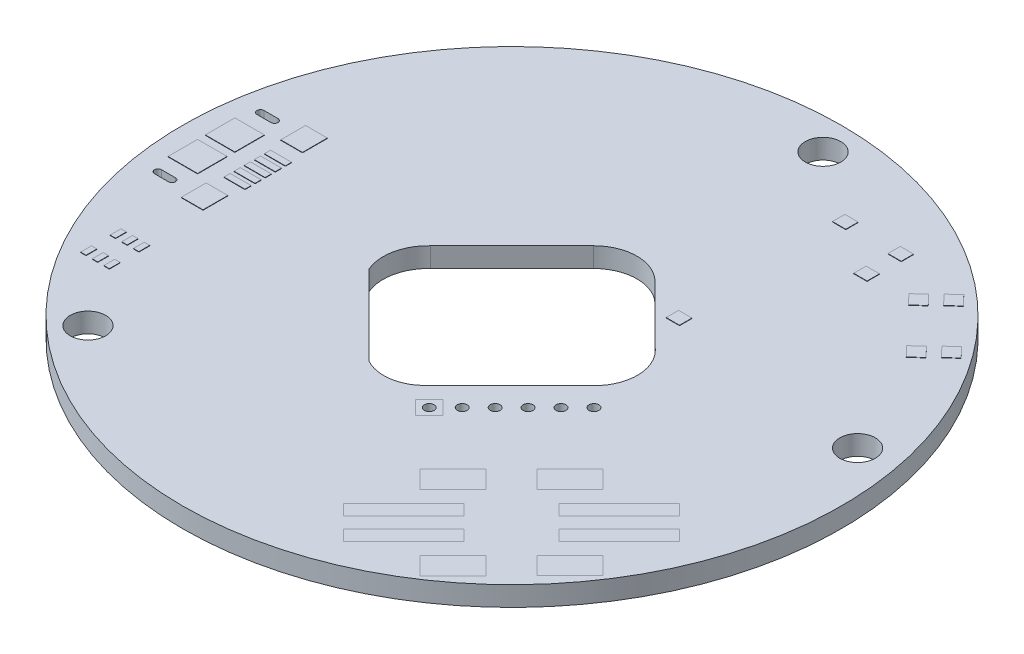
from build123d import *

# Parameters (mm, degrees)
SKETCH3_R                   = 21.209
SKETCH3_R_2                 = 1.143
SKETCH3_R_3                 = 0.3175
BOSS_EXTRUDE1_DEPTH         = 1.27
BOSS_EXTRUDE3_DEPTH         = 1.27
BOSS_EXTRUDE3_2_DEPTH       = 1.27
BOSS_EXTRUDE3_3_DEPTH       = 1.27
BOSS_EXTRUDE3_4_DEPTH       = 1.27
BOSS_EXTRUDE3_5_DEPTH       = 1.27
BOSS_EXTRUDE3_6_DEPTH       = 1.27
BOSS_EXTRUDE3_7_DEPTH       = 1.27
BOSS_EXTRUDE3_8_DEPTH       = 1.27
BOSS_EXTRUDE3_9_DEPTH       = 1.27
SKETCH5_R                   = 0.3175
CUT_EXTRUDE1_DEPTH          = 1.27
BOSS_EXTRUDE5_DEPTH         = 0.0254
BOSS_EXTRUDE5_DEPTH_BACK    = 1.27
SKETCH6_W                   = 0.350012
SKETCH6_H                   = 0.6999986
BOSS_EXTRUDE5_2_DEPTH       = 0.0254
BOSS_EXTRUDE5_2_DEPTH_BACK  = 1.27
BOSS_EXTRUDE5_3_DEPTH       = 0.0254
BOSS_EXTRUDE5_3_DEPTH_BACK  = 1.27
BOSS_EXTRUDE5_4_DEPTH       = 0.0254
BOSS_EXTRUDE5_4_DEPTH_BACK  = 1.27
BOSS_EXTRUDE5_5_DEPTH       = 0.0254
BOSS_EXTRUDE5_5_DEPTH_BACK  = 1.27
BOSS_EXTRUDE5_6_DEPTH       = 0.0254
BOSS_EXTRUDE5_6_DEPTH_BACK  = 1.27
BOSS_EXTRUDE5_7_DEPTH       = 0.0254
BOSS_EXTRUDE5_7_DEPTH_BACK  = 1.27
SKETCH6_W_2                 = 1.3999972
SKETCH6_H_2                 = 1.5999968
BOSS_EXTRUDE5_8_DEPTH       = 0.0254
BOSS_EXTRUDE5_8_DEPTH_BACK  = 1.27
SKETCH6_W_3                 = 1.8999962
SKETCH6_H_3                 = 1.8999962
BOSS_EXTRUDE5_9_DEPTH       = 0.0254
BOSS_EXTRUDE5_9_DEPTH_BACK  = 1.27
BOSS_EXTRUDE5_10_DEPTH      = 0.0254
BOSS_EXTRUDE5_10_DEPTH_BACK = 1.27
BOSS_EXTRUDE5_11_DEPTH      = 0.0254
BOSS_EXTRUDE5_11_DEPTH_BACK = 1.27
SKETCH6_W_4                 = 1.35001
SKETCH6_H_4                 = 0.3999992
BOSS_EXTRUDE5_12_DEPTH      = 0.0254
BOSS_EXTRUDE5_12_DEPTH_BACK = 1.27
BOSS_EXTRUDE5_13_DEPTH      = 0.0254
BOSS_EXTRUDE5_13_DEPTH_BACK = 1.27
BOSS_EXTRUDE5_14_DEPTH      = 0.0254
BOSS_EXTRUDE5_14_DEPTH_BACK = 1.27
BOSS_EXTRUDE5_15_DEPTH      = 0.0254
BOSS_EXTRUDE5_15_DEPTH_BACK = 1.27
CUT_EXTRUDE2_DEPTH          = 1.27
BOSS_EXTRUDE6_DEPTH         = 0.0254
BOSS_EXTRUDE6_DEPTH_BACK    = 1.27
BOSS_EXTRUDE6_2_DEPTH       = 0.0254
BOSS_EXTRUDE6_2_DEPTH_BACK  = 1.27
BOSS_EXTRUDE6_3_DEPTH       = 0.0254
BOSS_EXTRUDE6_3_DEPTH_BACK  = 1.27
BOSS_EXTRUDE6_4_DEPTH       = 0.0254
BOSS_EXTRUDE6_4_DEPTH_BACK  = 1.27
BOSS_EXTRUDE6_5_DEPTH       = 0.0254
BOSS_EXTRUDE6_5_DEPTH_BACK  = 1.27
BOSS_EXTRUDE6_6_DEPTH       = 0.0254
BOSS_EXTRUDE6_6_DEPTH_BACK  = 1.27
BOSS_EXTRUDE6_7_DEPTH       = 0.0254
BOSS_EXTRUDE6_7_DEPTH_BACK  = 1.27
BOSS_EXTRUDE6_8_DEPTH       = 0.0254
BOSS_EXTRUDE6_8_DEPTH_BACK  = 1.27
BOSS_EXTRUDE8_DEPTH         = 1.778
BOSS_EXTRUDE9_START         = -0.00254
BOSS_EXTRUDE9_OUTLINE_W     = 0.8599932
BOSS_EXTRUDE9_OUTLINE_H     = 0.7999984
BOSS_EXTRUDE9_DEPTH         = 0.02794
BOSS_EXTRUDE9_2_OUTLINE_W   = 0.8599932
BOSS_EXTRUDE9_2_OUTLINE_H   = 0.7999984
BOSS_EXTRUDE9_2_DEPTH       = 0.02794
BOSS_EXTRUDE9_3_DEPTH       = 0.02794
BOSS_EXTRUDE9_4_DEPTH       = 0.02794
BOSS_EXTRUDE9_5_DEPTH       = 0.02794
BOSS_EXTRUDE9_6_DEPTH       = 0.02794
BOSS_EXTRUDE9_7_OUTLINE_W   = 0.8599932
BOSS_EXTRUDE9_7_OUTLINE_H   = 0.7999984
BOSS_EXTRUDE9_7_DEPTH       = 0.02794
BOSS_EXTRUDE9_8_OUTLINE_W   = 0.8599932
BOSS_EXTRUDE9_8_OUTLINE_H   = 0.7999984
BOSS_EXTRUDE9_8_DEPTH       = 0.02794


# Read off the part's stored shape, not the designer's step: Boss-Extrude8, Boss-Extrude9
with BuildPart() as part:
    # Sketch3 → Boss-Extrude1 (new body)
    with BuildSketch(Plane(origin=(0, 0, 0), x_dir=(1, 0, 0), z_dir=(0, 1, 0))):
        with Locations(Location((0, 0, 0), (0, 0, 270))):
            Circle(SKETCH3_R)
        with Locations(Location((-13.090326502, -14.20017464, 0), (0, 0, 270))):
            Circle(SKETCH3_R_2, mode=Mode.SUBTRACT)
        with BuildLine():
            ThreePointArc((-1.2703302, 6.519164), (0.698070661, 7.338252187), (2.6717498, 6.5319656))
            Line((2.6717498, 6.5319656), (6.578981, 2.6405078))
            ThreePointArc((6.578981, 2.6405078), (7.363740488, 0.814468366), (6.7227958, -1.0668762))
            ThreePointArc((6.7227958, -1.0668762), (3.871033901, -3.904885416), (1.0291826, -6.7528186))
            ThreePointArc((1.0291826, -6.7528186), (-0.462677673, -7.449933453), (-2.0779994, -7.1300086))
            Line((-2.0779994, -7.1300086), (-7.1967344, -2.0112482))
            ThreePointArc((-7.1967344, -2.0112482), (-7.376547613, -0.261337244), (-6.5163446, 1.2731242))
            Line((-6.5163446, 1.2731242), (-1.2703302, 6.519164))
        make_face(mode=Mode.SUBTRACT)
        Polygon((10.345452676, -13.426869757), (11.052558043, -14.133975124), (7.163478524, -18.023054643), (6.456373157, -17.315949276), align=None, mode=Mode.SUBTRACT)
        Polygon((8.931231476, -12.012648557), (9.638336843, -12.719753924), (5.749257324, -16.608833443), (5.042151957, -15.901728076), align=None, mode=Mode.SUBTRACT)
        Polygon((7.729147757, -9.396368656), (8.860516344, -10.527737243), (6.739200243, -12.649053344), (5.607831656, -11.517684757), align=None, mode=Mode.SUBTRACT)
        Polygon((12.537494757, -14.204690256), (13.668863344, -15.336058843), (11.547547243, -17.457374944), (10.416178656, -16.326006357), align=None, mode=Mode.SUBTRACT)
        Polygon((15.297450843, -13.694237944), (14.166082256, -12.562869357), (16.287398357, -10.441553256), (17.418766944, -11.572921843), align=None, mode=Mode.SUBTRACT)
        Polygon((14.095367124, -11.077958043), (13.388261757, -10.370852676), (17.277341276, -6.481773157), (17.984446643, -7.188878524), align=None, mode=Mode.SUBTRACT)
        Polygon((3.361901812, -7.7877162), (2.4638762, -8.685741812), (1.565850588, -7.7877162), (2.4638762, -6.889690588), align=None, mode=Mode.SUBTRACT)
        with Locations(Location((3.5235388, -6.7280536, 0), (0, 0, 270))):
            Circle(SKETCH3_R_3, mode=Mode.SUBTRACT)
        with Locations(Location((4.5832014, -5.668391, 0), (0, 0, 270))):
            Circle(SKETCH3_R_3, mode=Mode.SUBTRACT)
        with Locations(Location((5.6428894, -4.608703, 0), (0, 0, 270))):
            Circle(SKETCH3_R_3, mode=Mode.SUBTRACT)
        with Locations(Location((6.702552, -3.5490404, 0), (0, 0, 270))):
            Circle(SKETCH3_R_3, mode=Mode.SUBTRACT)
        with Locations(Location((7.7622146, -2.4893778, 0), (0, 0, 270))):
            Circle(SKETCH3_R_3, mode=Mode.SUBTRACT)
        Polygon((10.489129243, -8.885916344), (9.357760656, -7.754547757), (11.479076757, -5.633231656), (12.610445344, -6.764600243), align=None, mode=Mode.SUBTRACT)
        Polygon((12.681171324, -9.663736843), (11.974065957, -8.956631476), (15.863145476, -5.067551957), (16.570250843, -5.774657324), align=None, mode=Mode.SUBTRACT)
        with Locations(Location((0.879673498, 19.13732536, 0), (0, 0, 270))):
            Circle(SKETCH3_R_2, mode=Mode.SUBTRACT)
        with Locations(Location((18.500923498, 3.73857536, 0), (0, 0, 270))):
            Circle(SKETCH3_R_2, mode=Mode.SUBTRACT)
    extrude(amount=-BOSS_EXTRUDE1_DEPTH)

    # Sketch6<4> → Cut-Extrude2 (cut)
    with BuildSketch(Plane(origin=(0, 0, 0), x_dir=(1, 0, 0), z_dir=(0, 1, 0))):
        with BuildLine():
            Line((-18.514082797, 3.003570258), (-19.414080997, 3.003570258))
            ThreePointArc((-19.414080997, 3.003570258), (-19.639080547, 3.228569808), (-19.414080997, 3.453569358))
            Line((-19.414080997, 3.453569358), (-18.514082797, 3.453569358))
            ThreePointArc((-18.514082797, 3.453569358), (-18.289083247, 3.228569808), (-18.514082797, 3.003570258))
        make_face()
        with BuildLine():
            Line((-18.514082797, -3.596416542), (-19.414080997, -3.596416542))
            ThreePointArc((-19.414080997, -3.596416542), (-19.639080547, -3.371416992), (-19.414080997, -3.146417442))
            Line((-19.414080997, -3.146417442), (-18.514082797, -3.146417442))
            ThreePointArc((-18.514082797, -3.146417442), (-18.289083247, -3.371416992), (-18.514082797, -3.596416542))
        make_face()
    extrude(amount=-CUT_EXTRUDE2_DEPTH, mode=Mode.SUBTRACT)

    # Boss-Extrude8 outline → Boss-Extrude8 (add)
    with BuildSketch(Plane.XZ.offset(1.27)):
        Polygon((-9.362084568, -9.903882913), (-9.362084568, -13.383772745), (-4.051602282, -13.383772745), (-4.078868321, -9.903882913), align=None)
    extrude(amount=BOSS_EXTRUDE8_DEPTH)


with BuildPart() as body_2:
    # Sketch3<4> → Boss-Extrude3 (new body)
    with BuildSketch(Plane(origin=(0, 0, 0), x_dir=(1, 0, 0), z_dir=(0, 1, 0))):
        Polygon((5.042151957, -15.901728076), (5.749257324, -16.608833443), (9.638336843, -12.719753924), (8.931231476, -12.012648557), align=None)
    extrude(amount=-BOSS_EXTRUDE3_DEPTH)


with BuildPart() as body_3:
    # Sketch3<4> → Boss-Extrude3 2 (new body)
    with BuildSketch(Plane(origin=(0, 0, 0), x_dir=(1, 0, 0), z_dir=(0, 1, 0))):
        Polygon((5.607831656, -11.517684757), (6.739200243, -12.649053344), (8.860516344, -10.527737243), (7.729147757, -9.396368656), align=None)
    extrude(amount=-BOSS_EXTRUDE3_2_DEPTH)


with BuildPart() as body_4:
    # Sketch3<4> → Boss-Extrude3 3 (new body)
    with BuildSketch(Plane(origin=(0, 0, 0), x_dir=(1, 0, 0), z_dir=(0, 1, 0))):
        Polygon((12.610445344, -6.764600243), (11.479076757, -5.633231656), (9.357760656, -7.754547757), (10.489129243, -8.885916344), align=None)
    extrude(amount=-BOSS_EXTRUDE3_3_DEPTH)


with BuildPart() as body_5:
    # Sketch3<4> → Boss-Extrude3 4 (new body)
    with BuildSketch(Plane(origin=(0, 0, 0), x_dir=(1, 0, 0), z_dir=(0, 1, 0))):
        Polygon((16.570250843, -5.774657324), (15.863145476, -5.067551957), (11.974065957, -8.956631476), (12.681171324, -9.663736843), align=None)
    extrude(amount=-BOSS_EXTRUDE3_4_DEPTH)


with BuildPart() as body_6:
    # Sketch3<4> → Boss-Extrude3 5 (new body)
    with BuildSketch(Plane(origin=(0, 0, 0), x_dir=(1, 0, 0), z_dir=(0, 1, 0))):
        Polygon((17.984446643, -7.188878524), (17.277341276, -6.481773157), (13.388261757, -10.370852676), (14.095367124, -11.077958043), align=None)
    extrude(amount=-BOSS_EXTRUDE3_5_DEPTH)


with BuildPart() as body_7:
    # Sketch3<4> → Boss-Extrude3 6 (new body)
    with BuildSketch(Plane(origin=(0, 0, 0), x_dir=(1, 0, 0), z_dir=(0, 1, 0))):
        Polygon((2.4638762, -6.889690588), (1.565850588, -7.7877162), (2.4638762, -8.685741812), (3.361901812, -7.7877162), align=None)
    extrude(amount=-BOSS_EXTRUDE3_6_DEPTH)

    # Sketch5 → Cut-Extrude1 (cut)
    with BuildSketch(Plane(origin=(0, 0, 0), x_dir=(1, 0, 0), z_dir=(0, 1, 0))):
        with Locations(Location((2.4638762, -7.7877162, 0), (0, 0, 270))):
            Circle(SKETCH5_R)
    extrude(amount=-CUT_EXTRUDE1_DEPTH, mode=Mode.SUBTRACT)


with BuildPart() as body_8:
    # Sketch3<4> → Boss-Extrude3 7 (new body)
    with BuildSketch(Plane(origin=(0, 0, 0), x_dir=(1, 0, 0), z_dir=(0, 1, 0))):
        Polygon((16.287398357, -10.441553256), (14.166082256, -12.562869357), (15.297450843, -13.694237944), (17.418766944, -11.572921843), align=None)
    extrude(amount=-BOSS_EXTRUDE3_7_DEPTH)


with BuildPart() as body_9:
    # Sketch3<4> → Boss-Extrude3 8 (new body)
    with BuildSketch(Plane(origin=(0, 0, 0), x_dir=(1, 0, 0), z_dir=(0, 1, 0))):
        Polygon((12.537494757, -14.204690256), (10.416178656, -16.326006357), (11.547547243, -17.457374944), (13.668863344, -15.336058843), align=None)
    extrude(amount=-BOSS_EXTRUDE3_8_DEPTH)


with BuildPart() as body_10:
    # Sketch3<4> → Boss-Extrude3 9 (new body)
    with BuildSketch(Plane(origin=(0, 0, 0), x_dir=(1, 0, 0), z_dir=(0, 1, 0))):
        Polygon((7.163478524, -18.023054643), (11.052558043, -14.133975124), (10.345452676, -13.426869757), (6.456373157, -17.315949276), align=None)
    extrude(amount=-BOSS_EXTRUDE3_9_DEPTH)


with BuildPart() as body_11:
    # Sketch6 → Boss-Extrude5 (new, two sides: drawn at the far end of the back side and taken through both)
    with BuildSketch(Plane(origin=(0, 0, 0), x_dir=(1, 0, 0), z_dir=(0, 1, 0)).offset(-BOSS_EXTRUDE5_DEPTH_BACK)):
        with Locations((-17.221113384, -8.116102184)):
            Rectangle(SKETCH6_W, SKETCH6_H)
    extrude(amount=BOSS_EXTRUDE5_DEPTH + BOSS_EXTRUDE5_DEPTH_BACK)


with BuildPart() as body_12:
    # Sketch6 → Boss-Extrude5 2 (new, two sides: drawn at the far end of the back side and taken through both)
    with BuildSketch(Plane(origin=(0, 0, 0), x_dir=(1, 0, 0), z_dir=(0, 1, 0)).offset(-BOSS_EXTRUDE5_2_DEPTH_BACK)):
        with Locations((-16.471102184, -8.116102184)):
            Rectangle(SKETCH6_W, SKETCH6_H)
    extrude(amount=BOSS_EXTRUDE5_2_DEPTH + BOSS_EXTRUDE5_2_DEPTH_BACK)


with BuildPart() as body_13:
    # Sketch6 → Boss-Extrude5 3 (new, two sides: drawn at the far end of the back side and taken through both)
    with BuildSketch(Plane(origin=(0, 0, 0), x_dir=(1, 0, 0), z_dir=(0, 1, 0)).offset(-BOSS_EXTRUDE5_3_DEPTH_BACK)):
        with Locations((-17.221113384, -10.016123784)):
            Rectangle(SKETCH6_W, SKETCH6_H)
    extrude(amount=BOSS_EXTRUDE5_3_DEPTH + BOSS_EXTRUDE5_3_DEPTH_BACK)


with BuildPart() as body_14:
    # Sketch6 → Boss-Extrude5 4 (new, two sides: drawn at the far end of the back side and taken through both)
    with BuildSketch(Plane(origin=(0, 0, 0), x_dir=(1, 0, 0), z_dir=(0, 1, 0)).offset(-BOSS_EXTRUDE5_4_DEPTH_BACK)):
        with Locations((-16.471102184, -10.016123784)):
            Rectangle(SKETCH6_W, SKETCH6_H)
    extrude(amount=BOSS_EXTRUDE5_4_DEPTH + BOSS_EXTRUDE5_4_DEPTH_BACK)


with BuildPart() as body_15:
    # Sketch6 → Boss-Extrude5 5 (new, two sides: drawn at the far end of the back side and taken through both)
    with BuildSketch(Plane(origin=(0, 0, 0), x_dir=(1, 0, 0), z_dir=(0, 1, 0)).offset(-BOSS_EXTRUDE5_5_DEPTH_BACK)):
        with Locations((-15.721090984, -10.016123784)):
            Rectangle(SKETCH6_W, SKETCH6_H)
    extrude(amount=BOSS_EXTRUDE5_5_DEPTH + BOSS_EXTRUDE5_5_DEPTH_BACK)


with BuildPart() as body_16:
    # Sketch6 → Boss-Extrude5 6 (new, two sides: drawn at the far end of the back side and taken through both)
    with BuildSketch(Plane(origin=(0, 0, 0), x_dir=(1, 0, 0), z_dir=(0, 1, 0)).offset(-BOSS_EXTRUDE5_6_DEPTH_BACK)):
        with Locations((-15.721090984, -8.116102184)):
            Rectangle(SKETCH6_W, SKETCH6_H)
    extrude(amount=BOSS_EXTRUDE5_6_DEPTH + BOSS_EXTRUDE5_6_DEPTH_BACK)


with BuildPart() as body_17:
    # Sketch6 → Boss-Extrude5 7 (new, two sides: drawn at the far end of the back side and taken through both)
    with BuildSketch(Plane(origin=(0, 0, 0), x_dir=(1, 0, 0), z_dir=(0, 1, 0)).offset(-BOSS_EXTRUDE5_7_DEPTH_BACK)):
        with Locations((-16.514074097, -3.271417192)):
            Rectangle(SKETCH6_W_2, SKETCH6_H_2)
    extrude(amount=BOSS_EXTRUDE5_7_DEPTH + BOSS_EXTRUDE5_7_DEPTH_BACK)


with BuildPart() as body_18:
    # Sketch6 → Boss-Extrude5 8 (new, two sides: drawn at the far end of the back side and taken through both)
    with BuildSketch(Plane(origin=(0, 0, 0), x_dir=(1, 0, 0), z_dir=(0, 1, 0)).offset(-BOSS_EXTRUDE5_8_DEPTH_BACK)):
        with Locations((-18.964081897, -1.271421192)):
            Rectangle(SKETCH6_W_3, SKETCH6_H_3)
    extrude(amount=BOSS_EXTRUDE5_8_DEPTH + BOSS_EXTRUDE5_8_DEPTH_BACK)


with BuildPart() as body_19:
    # Sketch6 → Boss-Extrude5 9 (new, two sides: drawn at the far end of the back side and taken through both)
    with BuildSketch(Plane(origin=(0, 0, 0), x_dir=(1, 0, 0), z_dir=(0, 1, 0)).offset(-BOSS_EXTRUDE5_9_DEPTH_BACK)):
        with Locations((-18.964081897, 1.128574008)):
            Rectangle(SKETCH6_W_3, SKETCH6_H_3)
    extrude(amount=BOSS_EXTRUDE5_9_DEPTH + BOSS_EXTRUDE5_9_DEPTH_BACK)


with BuildPart() as body_20:
    # Sketch6 → Boss-Extrude5 10 (new, two sides: drawn at the far end of the back side and taken through both)
    with BuildSketch(Plane(origin=(0, 0, 0), x_dir=(1, 0, 0), z_dir=(0, 1, 0)).offset(-BOSS_EXTRUDE5_10_DEPTH_BACK)):
        with Locations((-16.514074097, 3.128570008)):
            Rectangle(SKETCH6_W_2, SKETCH6_H_2)
    extrude(amount=BOSS_EXTRUDE5_10_DEPTH + BOSS_EXTRUDE5_10_DEPTH_BACK)


with BuildPart() as body_21:
    # Sketch6 → Boss-Extrude5 11 (new, two sides: drawn at the far end of the back side and taken through both)
    with BuildSketch(Plane(origin=(0, 0, 0), x_dir=(1, 0, 0), z_dir=(0, 1, 0)).offset(-BOSS_EXTRUDE5_11_DEPTH_BACK)):
        with Locations((-16.289080897, -1.371420992)):
            Rectangle(SKETCH6_W_4, SKETCH6_H_4)
    extrude(amount=BOSS_EXTRUDE5_11_DEPTH + BOSS_EXTRUDE5_11_DEPTH_BACK)


with BuildPart() as body_22:
    # Sketch6 → Boss-Extrude5 12 (new, two sides: drawn at the far end of the back side and taken through both)
    with BuildSketch(Plane(origin=(0, 0, 0), x_dir=(1, 0, 0), z_dir=(0, 1, 0)).offset(-BOSS_EXTRUDE5_12_DEPTH_BACK)):
        with Locations((-16.289080897, -0.071423592)):
            Rectangle(SKETCH6_W_4, SKETCH6_H_4)
    extrude(amount=BOSS_EXTRUDE5_12_DEPTH + BOSS_EXTRUDE5_12_DEPTH_BACK)


with BuildPart() as body_23:
    # Sketch6 → Boss-Extrude5 13 (new, two sides: drawn at the far end of the back side and taken through both)
    with BuildSketch(Plane(origin=(0, 0, 0), x_dir=(1, 0, 0), z_dir=(0, 1, 0)).offset(-BOSS_EXTRUDE5_13_DEPTH_BACK)):
        with Locations((-16.289080897, 0.578587808)):
            Rectangle(SKETCH6_W_4, SKETCH6_H_4)
    extrude(amount=BOSS_EXTRUDE5_13_DEPTH + BOSS_EXTRUDE5_13_DEPTH_BACK)


with BuildPart() as body_24:
    # Sketch6 → Boss-Extrude5 14 (new, two sides: drawn at the far end of the back side and taken through both)
    with BuildSketch(Plane(origin=(0, 0, 0), x_dir=(1, 0, 0), z_dir=(0, 1, 0)).offset(-BOSS_EXTRUDE5_14_DEPTH_BACK)):
        with Locations((-16.289080897, 1.228573808)):
            Rectangle(SKETCH6_W_4, SKETCH6_H_4)
    extrude(amount=BOSS_EXTRUDE5_14_DEPTH + BOSS_EXTRUDE5_14_DEPTH_BACK)


with BuildPart() as body_25:
    # Sketch6 → Boss-Extrude5 15 (new, two sides: drawn at the far end of the back side and taken through both)
    with BuildSketch(Plane(origin=(0, 0, 0), x_dir=(1, 0, 0), z_dir=(0, 1, 0)).offset(-BOSS_EXTRUDE5_15_DEPTH_BACK)):
        with Locations((-16.289080897, -0.721434992)):
            Rectangle(SKETCH6_W_4, SKETCH6_H_4)
    extrude(amount=BOSS_EXTRUDE5_15_DEPTH + BOSS_EXTRUDE5_15_DEPTH_BACK)


with BuildPart() as body_26:
    # Sketch8 → Boss-Extrude6 (new, two sides: drawn at the far end of the back side and taken through both)
    with BuildSketch(Plane.XZ.offset(1.27).offset(-BOSS_EXTRUDE6_DEPTH_BACK)):
        Polygon((-8.336050567, -9.855045787), (-8.936048793, -9.854215951), (-8.933835898, -8.254220682), (-8.333837672, -8.255050518), align=None)
    extrude(amount=BOSS_EXTRUDE6_DEPTH + BOSS_EXTRUDE6_DEPTH_BACK)


with BuildPart() as body_27:
    # Sketch8 → Boss-Extrude6 2 (new, two sides: drawn at the far end of the back side and taken through both)
    with BuildSketch(Plane.XZ.offset(1.27).offset(-BOSS_EXTRUDE6_2_DEPTH_BACK)):
        Polygon((-7.066051782, -9.856802277), (-7.666050008, -9.855972441), (-7.663837112, -8.255977171), (-7.063838886, -8.256807007), align=None)
    extrude(amount=BOSS_EXTRUDE6_2_DEPTH + BOSS_EXTRUDE6_2_DEPTH_BACK)


with BuildPart() as body_28:
    # Sketch8 → Boss-Extrude6 3 (new, two sides: drawn at the far end of the back side and taken through both)
    with BuildSketch(Plane.XZ.offset(1.27).offset(-BOSS_EXTRUDE6_3_DEPTH_BACK)):
        Polygon((-5.796052996, -9.858558766), (-6.396051223, -9.85772893), (-6.393838327, -8.25773366), (-5.793840101, -8.258563496), align=None)
    extrude(amount=BOSS_EXTRUDE6_3_DEPTH + BOSS_EXTRUDE6_3_DEPTH_BACK)


with BuildPart() as body_29:
    # Sketch8 → Boss-Extrude6 4 (new, two sides: drawn at the far end of the back side and taken through both)
    with BuildSketch(Plane.XZ.offset(1.27).offset(-BOSS_EXTRUDE6_4_DEPTH_BACK)):
        Polygon((-4.526054211, -9.860315255), (-5.126052437, -9.859485419), (-5.123839542, -8.25949015), (-4.523841316, -8.260319985), align=None)
    extrude(amount=BOSS_EXTRUDE6_4_DEPTH + BOSS_EXTRUDE6_4_DEPTH_BACK)


with BuildPart() as body_30:
    # Sketch8 → Boss-Extrude6 5 (new, two sides: drawn at the far end of the back side and taken through both)
    with BuildSketch(Plane.XZ.offset(1.27).offset(-BOSS_EXTRUDE6_5_DEPTH_BACK)):
        Polygon((-4.533246121, -15.060299882), (-5.133244347, -15.059470046), (-5.131031452, -13.459474776), (-4.531033226, -13.460304612), align=None)
    extrude(amount=BOSS_EXTRUDE6_5_DEPTH + BOSS_EXTRUDE6_5_DEPTH_BACK)


with BuildPart() as body_31:
    # Sketch8 → Boss-Extrude6 6 (new, two sides: drawn at the far end of the back side and taken through both)
    with BuildSketch(Plane.XZ.offset(1.27).offset(-BOSS_EXTRUDE6_6_DEPTH_BACK)):
        Polygon((-5.803244907, -15.058543392), (-6.403243133, -15.057713557), (-6.401030237, -13.457718287), (-5.801032011, -13.458548123), align=None)
    extrude(amount=BOSS_EXTRUDE6_6_DEPTH + BOSS_EXTRUDE6_6_DEPTH_BACK)


with BuildPart() as body_32:
    # Sketch8 → Boss-Extrude6 7 (new, two sides: drawn at the far end of the back side and taken through both)
    with BuildSketch(Plane.XZ.offset(1.27).offset(-BOSS_EXTRUDE6_7_DEPTH_BACK)):
        Polygon((-7.073243692, -15.056786903), (-7.673241918, -15.055957067), (-7.671029023, -13.455961798), (-7.071030797, -13.456791633), align=None)
    extrude(amount=BOSS_EXTRUDE6_7_DEPTH + BOSS_EXTRUDE6_7_DEPTH_BACK)


with BuildPart() as body_33:
    # Sketch8 → Boss-Extrude6 8 (new, two sides: drawn at the far end of the back side and taken through both)
    with BuildSketch(Plane.XZ.offset(1.27).offset(-BOSS_EXTRUDE6_8_DEPTH_BACK)):
        Polygon((-8.341029582, -13.455035144), (-8.343242477, -15.055030414), (-8.943240703, -15.054200578), (-8.941027808, -13.454205308), align=None)
    extrude(amount=BOSS_EXTRUDE6_8_DEPTH + BOSS_EXTRUDE6_8_DEPTH_BACK)


with BuildPart() as body_34:
    # Boss-Extrude9 outline → Boss-Extrude9 (new body)
    with BuildSketch(Plane(origin=(0, 0, 0), x_dir=(1, 0, 0), z_dir=(0, 1, 0)).offset(BOSS_EXTRUDE9_START)):
        with Locations((9.091447884, 13.729035114)):
            Rectangle(BOSS_EXTRUDE9_OUTLINE_W, BOSS_EXTRUDE9_OUTLINE_H)
    extrude(amount=BOSS_EXTRUDE9_DEPTH)


with BuildPart() as body_35:
    # Boss-Extrude9 2 outline → Boss-Extrude9 2 (new body)
    with BuildSketch(Plane(origin=(0, 0, 0), x_dir=(1, 0, 0), z_dir=(0, 1, 0)).offset(BOSS_EXTRUDE9_START)):
        with Locations((5.521452484, 5.229026714)):
            Rectangle(BOSS_EXTRUDE9_2_OUTLINE_W, BOSS_EXTRUDE9_2_OUTLINE_H)
    extrude(amount=BOSS_EXTRUDE9_2_DEPTH)


with BuildPart() as body_36:
    # Boss-Extrude9 3 outline → Boss-Extrude9 3 (new body)
    with BuildSketch(Plane(origin=(0, 0, 0), x_dir=(1, 0, 0), z_dir=(0, 1, 0)).offset(BOSS_EXTRUDE9_START)):
        Polygon((13.386108996, 15.692440774), (12.734355624, 15.071784426), (13.355011972, 14.420031054), (14.006765344, 15.040687402), align=None)
    extrude(amount=BOSS_EXTRUDE9_3_DEPTH)


with BuildPart() as body_37:
    # Boss-Extrude9 4 outline → Boss-Extrude9 4 (new body)
    with BuildSketch(Plane(origin=(0, 0, 0), x_dir=(1, 0, 0), z_dir=(0, 1, 0)).offset(BOSS_EXTRUDE9_START)):
        Polygon((16.213535396, 12.723333174), (15.561782024, 12.102676826), (16.182438372, 11.450923454), (16.834191744, 12.071579802), align=None)
    extrude(amount=BOSS_EXTRUDE9_4_DEPTH)


with BuildPart() as body_38:
    # Boss-Extrude9 5 outline → Boss-Extrude9 5 (new body)
    with BuildSketch(Plane(origin=(0, 0, 0), x_dir=(1, 0, 0), z_dir=(0, 1, 0)).offset(BOSS_EXTRUDE9_START)):
        Polygon((15.054863596, 11.619957174), (14.403110224, 10.999300826), (15.023766572, 10.347547454), (15.675519944, 10.968203802), align=None)
    extrude(amount=BOSS_EXTRUDE9_5_DEPTH)


with BuildPart() as body_39:
    # Boss-Extrude9 6 outline → Boss-Extrude9 6 (new body)
    with BuildSketch(Plane(origin=(0, 0, 0), x_dir=(1, 0, 0), z_dir=(0, 1, 0)).offset(BOSS_EXTRUDE9_START)):
        Polygon((12.227437196, 14.589064774), (11.575683824, 13.968408426), (12.196340172, 13.316655054), (12.848093544, 13.937311402), align=None)
    extrude(amount=BOSS_EXTRUDE9_6_DEPTH)


with BuildPart() as body_40:
    # Boss-Extrude9 7 outline → Boss-Extrude9 7 (new body)
    with BuildSketch(Plane(origin=(0, 0, 0), x_dir=(1, 0, 0), z_dir=(0, 1, 0)).offset(BOSS_EXTRUDE9_START)):
        with Locations((9.091447884, 15.929030714)):
            Rectangle(BOSS_EXTRUDE9_7_OUTLINE_W, BOSS_EXTRUDE9_7_OUTLINE_H)
    extrude(amount=BOSS_EXTRUDE9_7_DEPTH)


with BuildPart() as body_41:
    # Boss-Extrude9 8 outline → Boss-Extrude9 8 (new body)
    with BuildSketch(Plane(origin=(0, 0, 0), x_dir=(1, 0, 0), z_dir=(0, 1, 0)).offset(BOSS_EXTRUDE9_START)):
        with Locations((5.521452484, 15.929030714)):
            Rectangle(BOSS_EXTRUDE9_8_OUTLINE_W, BOSS_EXTRUDE9_8_OUTLINE_H)
    extrude(amount=BOSS_EXTRUDE9_8_DEPTH)


solid = Compound([part.part, body_2.part, body_3.part, body_4.part, body_5.part, body_6.part, body_7.part, body_8.part, body_9.part, body_10.part, body_11.part, body_12.part, body_13.part, body_14.part, body_15.part, body_16.part, body_17.part, body_18.part, body_19.part, body_20.part, body_21.part, body_22.part, body_23.part, body_24.part, body_25.part, body_26.part, body_27.part, body_28.part, body_29.part, body_30.part, body_31.part, body_32.part, body_33.part, body_34.part, body_35.part, body_36.part, body_37.part, body_38.part, body_39.part, body_40.part, body_41.part])
